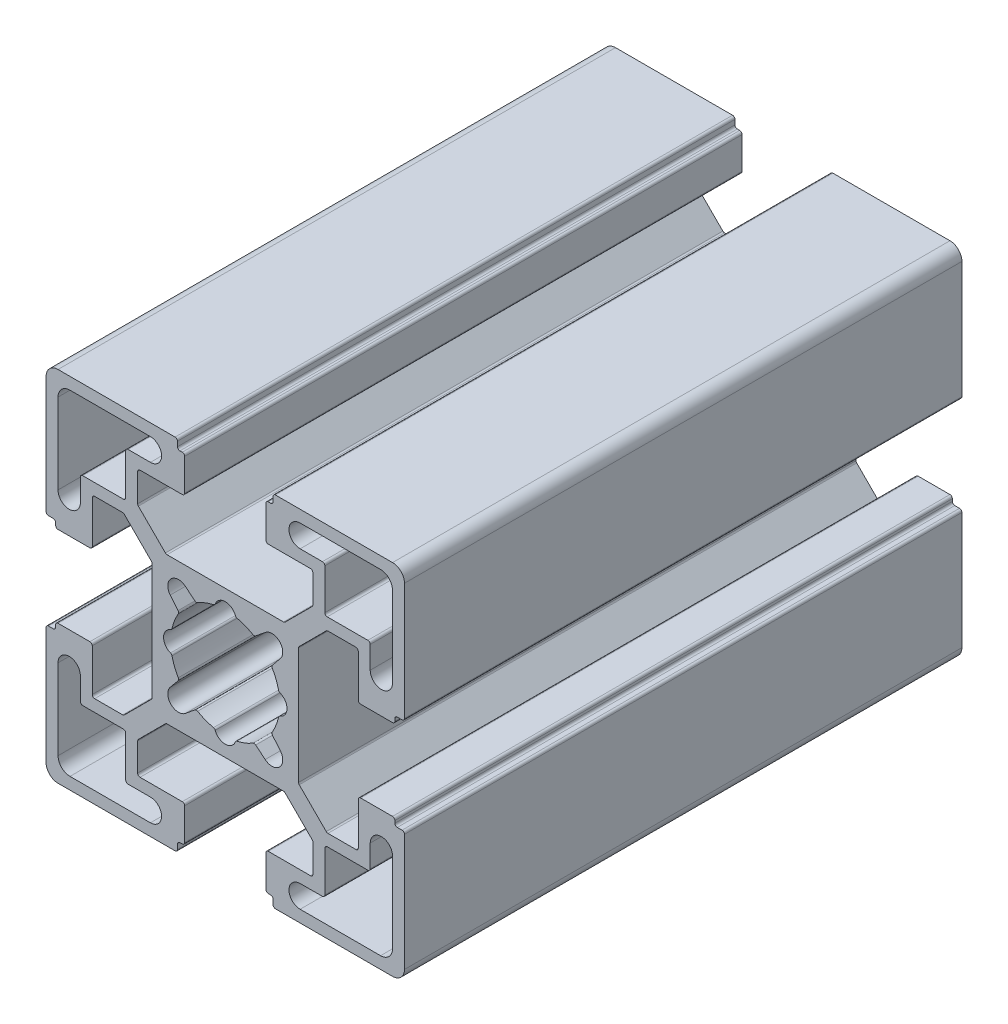
from build123d import *

# Parameters (mm, degrees)
RESSALTO_EXTRUS_O2_DEPTH = 70


with BuildPart() as part:
    # Sketch1 → Ressalto-extrusão2 (new body)
    with BuildSketch(Plane.XY):
        with BuildLine():
            ThreePointArc((22.2, 6), (22.412132034, 6.087867966), (22.5, 6.3))
            Line((22.5, 6.3), (22.5, 21))
            ThreePointArc((22.5, 21), (22.060660172, 22.060660172), (21, 22.5))
            Line((21, 22.5), (6.3, 22.5))
            ThreePointArc((6.3, 22.5), (6.087867966, 22.412132034), (6, 22.2))
            Line((6, 22.2), (6, 21.6))
            ThreePointArc((6, 21.6), (5.912132034, 21.387867966), (5.7, 21.3))
            Line((5.7, 21.3), (5.4, 21.3))
            ThreePointArc((5.4, 21.3), (5.187867966, 21.212132034), (5.1, 21))
            Line((5.1, 21), (5.1, 17))
            ThreePointArc((5.1, 17), (5.187867966, 16.787867966), (5.4, 16.7))
            Line((5.4, 16.7), (10.7, 16.7))
            ThreePointArc((10.7, 16.7), (10.912132034, 16.612132034), (11, 16.4))
            Line((11, 16.4), (11, 12.892031022))
            ThreePointArc((11, 12.892031022), (10.97716386, 12.777225992), (10.912132034, 12.679898987))
            Line((10.912132034, 12.679898987), (7.520101013, 9.287867966))
            ThreePointArc((7.520101013, 9.287867966), (7.422774008, 9.22283614), (7.307968978, 9.2))
            Line((7.307968978, 9.2), (-7.307968978, 9.2))
            ThreePointArc((-7.307968978, 9.2), (-7.422774008, 9.22283614), (-7.520101013, 9.287867966))
            Line((-7.520101013, 9.287867966), (-10.912132034, 12.679898987))
            ThreePointArc((-10.912132034, 12.679898987), (-10.97716386, 12.777225992), (-11, 12.892031022))
            Line((-11, 12.892031022), (-11, 16.4))
            ThreePointArc((-11, 16.4), (-10.912132034, 16.612132034), (-10.7, 16.7))
            Line((-10.7, 16.7), (-5.4, 16.7))
            ThreePointArc((-5.4, 16.7), (-5.187867966, 16.787867966), (-5.1, 17))
            Line((-5.1, 17), (-5.1, 21))
            ThreePointArc((-5.1, 21), (-5.187867966, 21.212132034), (-5.4, 21.3))
            Line((-5.4, 21.3), (-5.7, 21.3))
            ThreePointArc((-5.7, 21.3), (-5.912132034, 21.387867966), (-6, 21.6))
            Line((-6, 21.6), (-6, 22.2))
            ThreePointArc((-6, 22.2), (-6.087867966, 22.412132034), (-6.3, 22.5))
            Line((-6.3, 22.5), (-21, 22.5))
            ThreePointArc((-21, 22.5), (-22.060660172, 22.060660172), (-22.5, 21))
            Line((-22.5, 21), (-22.5, 6.3))
            ThreePointArc((-22.5, 6.3), (-22.412132034, 6.087867966), (-22.2, 6))
            Line((-22.2, 6), (-21.6, 6))
            ThreePointArc((-21.6, 6), (-21.387867966, 5.912132034), (-21.3, 5.7))
            Line((-21.3, 5.7), (-21.3, 5.4))
            ThreePointArc((-21.3, 5.4), (-21.212132034, 5.187867966), (-21, 5.1))
            Line((-21, 5.1), (-17, 5.1))
            ThreePointArc((-17, 5.1), (-16.787867966, 5.187867966), (-16.7, 5.4))
            Line((-16.7, 5.4), (-16.7, 10.7))
            ThreePointArc((-16.7, 10.7), (-16.612132034, 10.912132034), (-16.4, 11))
            Line((-16.4, 11), (-12.892031022, 11))
            ThreePointArc((-12.892031022, 11), (-12.777225992, 10.97716386), (-12.679898987, 10.912132034))
            Line((-12.679898987, 10.912132034), (-9.287867966, 7.520101013))
            ThreePointArc((-9.287867966, 7.520101013), (-9.22283614, 7.422774008), (-9.2, 7.307968978))
            Line((-9.2, 7.307968978), (-9.2, -7.307968978))
            ThreePointArc((-9.2, -7.307968978), (-9.22283614, -7.422774008), (-9.287867966, -7.520101013))
            Line((-9.287867966, -7.520101013), (-12.679898987, -10.912132034))
            ThreePointArc((-12.679898987, -10.912132034), (-12.777225992, -10.97716386), (-12.892031022, -11))
            Line((-12.892031022, -11), (-16.4, -11))
            ThreePointArc((-16.4, -11), (-16.612132034, -10.912132034), (-16.7, -10.7))
            Line((-16.7, -10.7), (-16.7, -5.4))
            ThreePointArc((-16.7, -5.4), (-16.787867966, -5.187867966), (-17, -5.1))
            Line((-17, -5.1), (-21, -5.1))
            ThreePointArc((-21, -5.1), (-21.212132034, -5.187867966), (-21.3, -5.4))
            Line((-21.3, -5.4), (-21.3, -5.7))
            ThreePointArc((-21.3, -5.7), (-21.387867966, -5.912132034), (-21.6, -6))
            Line((-21.6, -6), (-22.2, -6))
            ThreePointArc((-22.2, -6), (-22.412132034, -6.087867966), (-22.5, -6.3))
            Line((-22.5, -6.3), (-22.5, -21))
            ThreePointArc((-22.5, -21), (-22.060660172, -22.060660172), (-21, -22.5))
            Line((-21, -22.5), (-6.3, -22.5))
            ThreePointArc((-6.3, -22.5), (-6.087867966, -22.412132034), (-6, -22.2))
            Line((-6, -22.2), (-6, -21.6))
            ThreePointArc((-6, -21.6), (-5.912132034, -21.387867966), (-5.7, -21.3))
            Line((-5.7, -21.3), (-5.4, -21.3))
            ThreePointArc((-5.4, -21.3), (-5.187867966, -21.212132034), (-5.1, -21))
            Line((-5.1, -21), (-5.1, -17))
            ThreePointArc((-5.1, -17), (-5.187867966, -16.787867966), (-5.4, -16.7))
            Line((-5.4, -16.7), (-10.7, -16.7))
            ThreePointArc((-10.7, -16.7), (-10.912132034, -16.612132034), (-11, -16.4))
            Line((-11, -16.4), (-11, -12.892031022))
            ThreePointArc((-11, -12.892031022), (-10.97716386, -12.777225992), (-10.912132034, -12.679898987))
            Line((-10.912132034, -12.679898987), (-7.432233047, -9.2))
            Line((-7.432233047, -9.2), (7.307968978, -9.2))
            ThreePointArc((7.307968978, -9.2), (7.422774008, -9.22283614), (7.520101013, -9.287867966))
            Line((7.520101013, -9.287867966), (10.912132034, -12.679898987))
            ThreePointArc((10.912132034, -12.679898987), (10.97716386, -12.777225992), (11, -12.892031022))
            Line((11, -12.892031022), (11, -16.4))
            ThreePointArc((11, -16.4), (10.912132034, -16.612132034), (10.7, -16.7))
            Line((10.7, -16.7), (5.4, -16.7))
            ThreePointArc((5.4, -16.7), (5.187867966, -16.787867966), (5.1, -17))
            Line((5.1, -17), (5.1, -21))
            ThreePointArc((5.1, -21), (5.187867966, -21.212132034), (5.4, -21.3))
            Line((5.4, -21.3), (5.7, -21.3))
            ThreePointArc((5.7, -21.3), (5.912132034, -21.387867966), (6, -21.6))
            Line((6, -21.6), (6, -22.2))
            ThreePointArc((6, -22.2), (6.087867966, -22.412132034), (6.3, -22.5))
            Line((6.3, -22.5), (21, -22.5))
            ThreePointArc((21, -22.5), (22.060660172, -22.060660172), (22.5, -21))
            Line((22.5, -21), (22.5, -6.3))
            ThreePointArc((22.5, -6.3), (22.412132034, -6.087867966), (22.2, -6))
            Line((22.2, -6), (21.6, -6))
            ThreePointArc((21.6, -6), (21.387867966, -5.912132034), (21.3, -5.7))
            Line((21.3, -5.7), (21.3, -5.4))
            ThreePointArc((21.3, -5.4), (21.212132034, -5.187867966), (21, -5.1))
            Line((21, -5.1), (17, -5.1))
            ThreePointArc((17, -5.1), (16.787867966, -5.187867966), (16.7, -5.4))
            Line((16.7, -5.4), (16.7, -10.7))
            ThreePointArc((16.7, -10.7), (16.612132034, -10.912132034), (16.4, -11))
            Line((16.4, -11), (12.892031022, -11))
            ThreePointArc((12.892031022, -11), (12.777225992, -10.97716386), (12.679898987, -10.912132034))
            Line((12.679898987, -10.912132034), (9.287867966, -7.520101013))
            ThreePointArc((9.287867966, -7.520101013), (9.22283614, -7.422774008), (9.2, -7.307968978))
            Line((9.2, -7.307968978), (9.2, 7.307968978))
            ThreePointArc((9.2, 7.307968978), (9.22283614, 7.422774008), (9.287867966, 7.520101013))
            Line((9.287867966, 7.520101013), (12.679898987, 10.912132034))
            ThreePointArc((12.679898987, 10.912132034), (12.777225992, 10.97716386), (12.892031022, 11))
            Line((12.892031022, 11), (16.4, 11))
            ThreePointArc((16.4, 11), (16.612132034, 10.912132034), (16.7, 10.7))
            Line((16.7, 10.7), (16.7, 5.4))
            ThreePointArc((16.7, 5.4), (16.787867966, 5.187867966), (17, 5.1))
            Line((17, 5.1), (21, 5.1))
            ThreePointArc((21, 5.1), (21.212132034, 5.187867966), (21.3, 5.4))
            Line((21.3, 5.4), (21.3, 5.7))
            ThreePointArc((21.3, 5.7), (21.387867966, 5.912132034), (21.6, 6))
            Line((21.6, 6), (22.2, 6))
        make_face()
        with BuildLine():
            Line((-9.4, -21), (-19.5, -21))
            ThreePointArc((-19.5, -21), (-20.560660172, -20.560660172), (-21, -19.5))
            Line((-21, -19.5), (-21, -9.4))
            ThreePointArc((-21, -9.4), (-19.6, -8), (-18.2, -9.4))
            Line((-18.2, -9.4), (-18.2, -12.2))
            ThreePointArc((-18.2, -12.2), (-18.112132034, -12.412132034), (-17.9, -12.5))
            Line((-17.9, -12.5), (-12.8, -12.5))
            ThreePointArc((-12.8, -12.5), (-12.587867966, -12.587867966), (-12.5, -12.8))
            Line((-12.5, -12.8), (-12.5, -17.9))
            ThreePointArc((-12.5, -17.9), (-12.412132034, -18.112132034), (-12.2, -18.2))
            Line((-12.2, -18.2), (-9.4, -18.2))
            ThreePointArc((-9.4, -18.2), (-8, -19.6), (-9.4, -21))
        make_face(mode=Mode.SUBTRACT)
        with BuildLine():
            Line((12.8, -12.5), (17.9, -12.5))
            ThreePointArc((17.9, -12.5), (18.112132034, -12.412132034), (18.2, -12.2))
            Line((18.2, -12.2), (18.2, -9.4))
            ThreePointArc((18.2, -9.4), (19.6, -8), (21, -9.4))
            Line((21, -9.4), (21, -19.5))
            ThreePointArc((21, -19.5), (20.560660172, -20.560660172), (19.5, -21))
            Line((19.5, -21), (9.4, -21))
            ThreePointArc((9.4, -21), (8, -19.6), (9.4, -18.2))
            Line((9.4, -18.2), (12.2, -18.2))
            ThreePointArc((12.2, -18.2), (12.412132034, -18.112132034), (12.5, -17.9))
            Line((12.5, -17.9), (12.5, -12.8))
            ThreePointArc((12.5, -12.8), (12.587867966, -12.587867966), (12.8, -12.5))
        make_face(mode=Mode.SUBTRACT)
        with BuildLine():
            Line((-18.2, 12.2), (-18.2, 9.4))
            ThreePointArc((-18.2, 9.4), (-19.6, 8), (-21, 9.4))
            Line((-21, 9.4), (-21, 19.5))
            ThreePointArc((-21, 19.5), (-20.560660172, 20.560660172), (-19.5, 21))
            Line((-19.5, 21), (-9.4, 21))
            ThreePointArc((-9.4, 21), (-8, 19.6), (-9.4, 18.2))
            Line((-9.4, 18.2), (-12.2, 18.2))
            ThreePointArc((-12.2, 18.2), (-12.412132034, 18.112132034), (-12.5, 17.9))
            Line((-12.5, 17.9), (-12.5, 12.8))
            ThreePointArc((-12.5, 12.8), (-12.587867966, 12.587867966), (-12.8, 12.5))
            Line((-12.8, 12.5), (-17.9, 12.5))
            ThreePointArc((-17.9, 12.5), (-18.112132034, 12.412132034), (-18.2, 12.2))
        make_face(mode=Mode.SUBTRACT)
        with BuildLine():
            Line((-5.011190062, 6.911428437), (-3.818215474, 5.929763323))
            ThreePointArc((-3.818215474, 5.929763323), (-3.651033002, 5.862334174), (-3.475387346, 5.902896136))
            ThreePointArc((-3.475387346, 5.902896136), (-2.50834603, 6.374221536), (-1.479437798, 6.68833042))
            ThreePointArc((-1.479437798, 6.68833042), (-1.347716602, 6.754573553), (-1.263461477, 6.875568182))
            ThreePointArc((-1.263461477, 6.875568182), (0, 7.75), (1.263461477, 6.875568182))
            ThreePointArc((1.263461477, 6.875568182), (1.347716602, 6.754573553), (1.479437798, 6.68833042))
            ThreePointArc((1.479437798, 6.68833042), (2.50834603, 6.374221536), (3.475387346, 5.902896136))
            ThreePointArc((3.475387346, 5.902896136), (3.651033002, 5.862334174), (3.818215474, 5.929763323))
            Line((3.818215474, 5.929763323), (5.011190062, 6.911428437))
            ThreePointArc((5.011190062, 6.911428437), (6.823580438, 6.823580438), (6.911428437, 5.011190062))
            Line((6.911428437, 5.011190062), (5.929763323, 3.818215474))
            ThreePointArc((5.929763323, 3.818215474), (5.862334174, 3.651033002), (5.902896136, 3.475387346))
            ThreePointArc((5.902896136, 3.475387346), (6.374221536, 2.50834603), (6.68833042, 1.479437798))
            ThreePointArc((6.68833042, 1.479437798), (6.754573553, 1.347716602), (6.875568182, 1.263461477))
            ThreePointArc((6.875568182, 1.263461477), (7.75, 0), (6.875568182, -1.263461477))
            ThreePointArc((6.875568182, -1.263461477), (6.754573553, -1.347716602), (6.68833042, -1.479437798))
            ThreePointArc((6.68833042, -1.479437798), (6.374221536, -2.50834603), (5.902896136, -3.475387346))
            ThreePointArc((5.902896136, -3.475387346), (5.862334174, -3.651033002), (5.929763323, -3.818215474))
            Line((5.929763323, -3.818215474), (6.911428437, -5.011190062))
            ThreePointArc((6.911428437, -5.011190062), (6.823580438, -6.823580438), (5.011190062, -6.911428437))
            Line((5.011190062, -6.911428437), (3.818215474, -5.929763323))
            ThreePointArc((3.818215474, -5.929763323), (3.651033002, -5.862334174), (3.475387346, -5.902896136))
            ThreePointArc((3.475387346, -5.902896136), (2.50834603, -6.374221536), (1.479437798, -6.68833042))
            ThreePointArc((1.479437798, -6.68833042), (1.347716602, -6.754573553), (1.263461477, -6.875568182))
            ThreePointArc((1.263461477, -6.875568182), (0, -7.75), (-1.263461477, -6.875568182))
            ThreePointArc((-1.263461477, -6.875568182), (-1.347716602, -6.754573553), (-1.479437798, -6.68833042))
            ThreePointArc((-1.479437798, -6.68833042), (-2.50834603, -6.374221536), (-3.475387346, -5.902896136))
            ThreePointArc((-3.475387346, -5.902896136), (-3.651033002, -5.862334174), (-3.818215474, -5.929763323))
            Line((-3.818215474, -5.929763323), (-5.011190062, -6.911428437))
            ThreePointArc((-5.011190062, -6.911428437), (-6.823580438, -6.823580438), (-6.911428437, -5.011190062))
            Line((-6.911428437, -5.011190062), (-5.929763323, -3.818215474))
            ThreePointArc((-5.929763323, -3.818215474), (-5.862334174, -3.651033002), (-5.902896136, -3.475387346))
            ThreePointArc((-5.902896136, -3.475387346), (-6.374221536, -2.50834603), (-6.68833042, -1.479437798))
            ThreePointArc((-6.68833042, -1.479437798), (-6.754573553, -1.347716602), (-6.875568182, -1.263461477))
            ThreePointArc((-6.875568182, -1.263461477), (-7.75, 0), (-6.875568182, 1.263461477))
            ThreePointArc((-6.875568182, 1.263461477), (-6.754573553, 1.347716602), (-6.68833042, 1.479437798))
            ThreePointArc((-6.68833042, 1.479437798), (-6.374221536, 2.50834603), (-5.902896136, 3.475387346))
            ThreePointArc((-5.902896136, 3.475387346), (-5.862334174, 3.651033002), (-5.929763323, 3.818215474))
            Line((-5.929763323, 3.818215474), (-6.911428437, 5.011190062))
            ThreePointArc((-6.911428437, 5.011190062), (-6.823580438, 6.823580438), (-5.011190062, 6.911428437))
        make_face(mode=Mode.SUBTRACT)
        with BuildLine():
            Line((9.4, 21), (19.5, 21))
            ThreePointArc((19.5, 21), (20.560660172, 20.560660172), (21, 19.5))
            Line((21, 19.5), (21, 9.4))
            ThreePointArc((21, 9.4), (19.6, 8), (18.2, 9.4))
            Line((18.2, 9.4), (18.2, 12.2))
            ThreePointArc((18.2, 12.2), (18.112132034, 12.412132034), (17.9, 12.5))
            Line((17.9, 12.5), (12.8, 12.5))
            ThreePointArc((12.8, 12.5), (12.587867966, 12.587867966), (12.5, 12.8))
            Line((12.5, 12.8), (12.5, 17.9))
            ThreePointArc((12.5, 17.9), (12.412132034, 18.112132034), (12.2, 18.2))
            Line((12.2, 18.2), (9.4, 18.2))
            ThreePointArc((9.4, 18.2), (8, 19.6), (9.4, 21))
        make_face(mode=Mode.SUBTRACT)
    extrude(amount=RESSALTO_EXTRUS_O2_DEPTH)


solid = part.part
